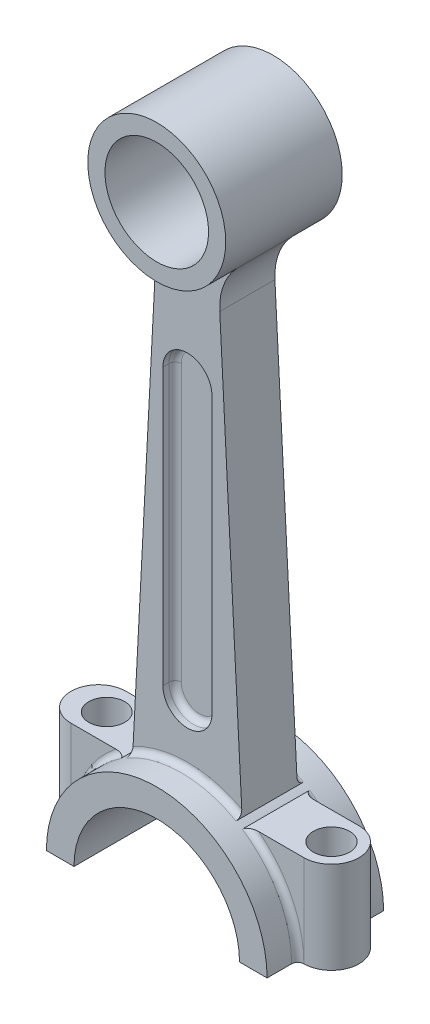
from build123d import *

# Parameters (mm, degrees)
BOSS_EXTRUDE1_DEPTH   = 19
SKETCH1_R             = 22.5
SKETCH1_R_2           = 16.9
BOSS_EXTRUDE1_2_DEPTH = 19
BOSS_EXTRUDE2_DEPTH   = 9
CUT_EXTRUDE1_DEPTH    = 4
FILLET1_R             = 2
FILLET2_R             = 20
SKETCH3_R             = 5.918580101
SKETCH3_R_2           = 5.86964533
BOSS_EXTRUDE3_DEPTH   = 30
CUT_EXTRUDE2_DEPTH    = 231.292618206
SKETCH5_R             = 5.86964533
SKETCH5_R_2           = 5.918580101
CUT_EXTRUDE3_DEPTH    = 201.224099449
FILLET3_R             = 2


with BuildPart() as part:
    # Sketch1 → Boss-Extrude1 (new, symmetric)
    with BuildSketch(Plane.XY):
        with BuildLine():
            ThreePointArc((-27, 0), (0, 27), (27, 0))
            Line((27, 0), (36, 0))
            ThreePointArc((36, 0), (0, 36), (-36, 0))
            Line((-36, 0), (-27, 0))
        make_face()
    extrude(amount=BOSS_EXTRUDE1_DEPTH, both=True)



with BuildPart() as body_2:
    # Sketch1 → Boss-Extrude1 2 (new, symmetric)
    with BuildSketch(Plane.XY):
        with Locations((0, 201.2)):
            Circle(SKETCH1_R)
        with Locations((0, 201.2)):
            Circle(SKETCH1_R_2, mode=Mode.SUBTRACT)
    extrude(amount=BOSS_EXTRUDE1_2_DEPTH, both=True)


with BuildPart() as part_1:
    add(part.part)

    add(body_2.part)  # Boss-Extrude2 merges body 2
    # Sketch1<3> → Boss-Extrude2 (add, symmetric)
    with BuildSketch(Plane.XY):
        with BuildLine():
            ThreePointArc((-17.849697213, 31.263210159), (0, 36), (17.849697213, 31.263210159))
            Line((17.849697213, 31.263210159), (10, 181.044355629))
            ThreePointArc((10, 181.044355629), (0, 178.7), (-10, 181.044355629))
            Line((-10, 181.044355629), (-17.849697213, 31.263210159))
        make_face()
    extrude(amount=BOSS_EXTRUDE2_DEPTH, both=True)

    # Sketch2 → Cut-Extrude1 (cut)
    with BuildSketch(Plane(origin=(0, 0, -9), x_dir=(-1, 0, 0), z_dir=(0, 0, -1))):
        with BuildLine():
            Line((8, 145.6), (8, 55.6))
            ThreePointArc((8, 55.6), (0, 47.6), (-8, 55.6))
            Line((-8, 55.6), (-8, 145.6))
            ThreePointArc((-8, 145.6), (0, 153.6), (8, 145.6))
        make_face()
    cut_extrude1 = extrude(amount=-CUT_EXTRUDE1_DEPTH, mode=Mode.SUBTRACT)

    # Mirror1: Cut-Extrude1 across plane
    add(cut_extrude1.mirror(Plane.XY), mode=Mode.SUBTRACT)

    # Fillet1
    fillet1_edges = [part_1.edges().sort_by_distance(p)[0] for p in [
        (8, 100.6, 5),
        (0, 47.6, 5),
        (-8, 100.6, 5),
        (0, 153.6, 5),
        (-8, 100.6, -5),
        (0, 47.6, -5),
        (8, 100.6, -5),
        (0, 153.6, -5),
    ]]
    fillet(fillet1_edges, radius=FILLET1_R)

    # Fillet2
    fillet2_edges = [part_1.edges().sort_by_distance(p)[0] for p in [
        (-10, 181.044355629, 0),
        (10, 181.044355629, 0),
    ]]
    fillet(fillet2_edges, radius=FILLET2_R)

    # Sketch3 → Boss-Extrude3 (add)
    with BuildSketch(Plane(origin=(0, 30, 0), x_dir=(-1, 0, 0), z_dir=(0, -1, 0))):
        with BuildLine():
            Line((-38, 9), (38, 9))
            ThreePointArc((38, 9), (47, 0), (38, -9))
            Line((38, -9), (-38, -9))
            ThreePointArc((-38, -9), (-47, 0), (-38, 9))
        make_face()
        with Locations((-38, 0)):
            Circle(SKETCH3_R, mode=Mode.SUBTRACT)
        with Locations((35.305532021, 0)):
            Circle(SKETCH3_R_2, mode=Mode.SUBTRACT)
    extrude(amount=BOSS_EXTRUDE3_DEPTH)

    # Sketch4 → Cut-Extrude2 (cut, through all)
    with BuildSketch(Plane(origin=(0, 0, -9), x_dir=(-1, 0, 0), z_dir=(0, 0, -1))):
        with BuildLine():
            Line((-27, 0), (27, 0))
            ThreePointArc((27, 0), (0, 27), (-27, 0))
        make_face()
    extrude(amount=-CUT_EXTRUDE2_DEPTH, mode=Mode.SUBTRACT)

    # Sketch5 → Cut-Extrude3 (cut, through all)
    with BuildSketch(Plane(origin=(0, 30, 0), x_dir=(1, 0, 0), z_dir=(0, 1, 0))):
        with Locations((-35.305532021, 0)):
            Circle(SKETCH5_R)
        with Locations((38, 0)):
            Circle(SKETCH5_R_2)
    extrude(amount=-CUT_EXTRUDE3_DEPTH, mode=Mode.SUBTRACT)

    # Fillet3
    fillet3_edges = [part_1.edges().sort_by_distance(p)[0] for p in [
        (-31.720584442, 17.023645986, -9),
        (0, 36, -9),
        (31.720584442, 17.023645986, -9),
        (31.720584442, 17.023645986, 9),
        (-31.720584442, 17.023645986, 9),
        (0, 36, 9),
    ]]
    fillet(fillet3_edges, radius=FILLET3_R)


solid = part_1.part
